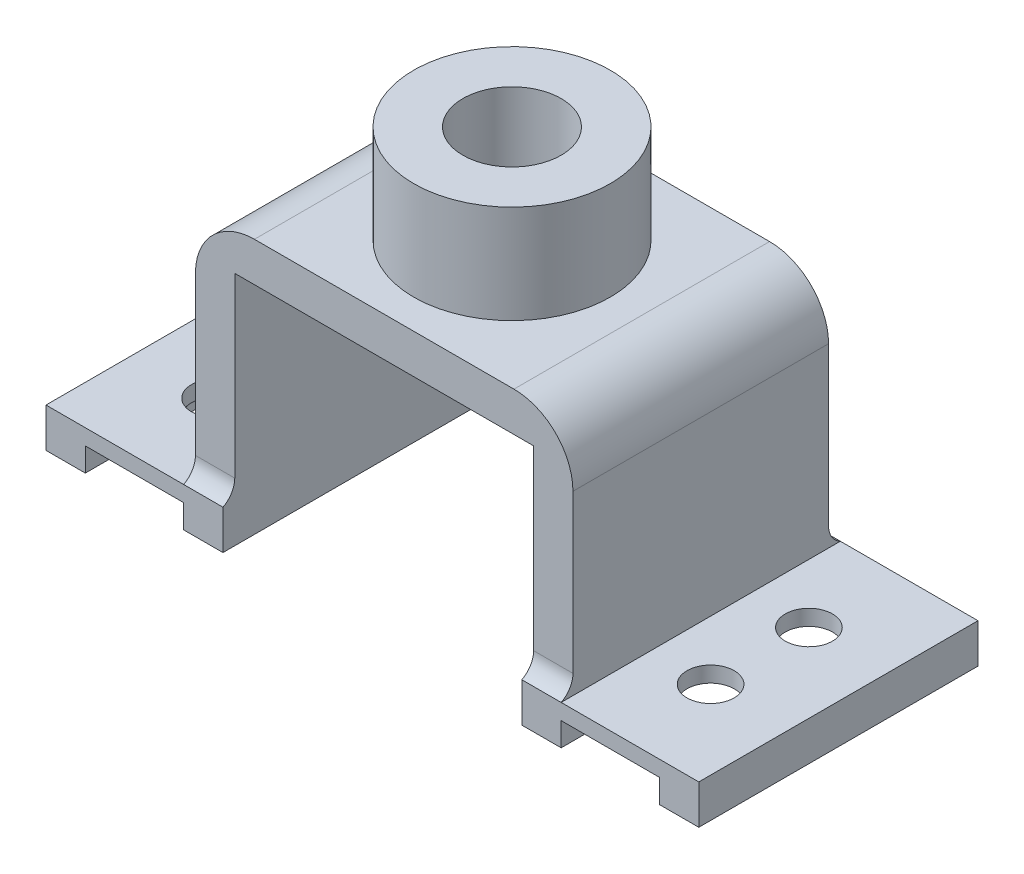
from build123d import *

# Parameters (mm, degrees)
SKETCH1_W           = 96
SKETCH1_H           = 70
BOSS_EXTRUDE1_DEPTH = 32.5
BOSS_EXTRUDE2_DEPTH = 35.5
SKETCH3_W           = 76
SKETCH3_H           = 60
CUT_EXTRUDE1_DEPTH  = 129.113231167
FILLET1_R           = 15
FILLET2_R           = 5.5
SKETCH4_R           = 25
SKETCH4_R_2         = 12.5
BOSS_EXTRUDE3_DEPTH = 25
HOLE1_D             = 12


with BuildPart() as part:
    # Sketch1 → Boss-Extrude1 (new, symmetric)
    with BuildSketch(Plane.XY):
        with Locations((0, 35)):
            Rectangle(SKETCH1_W, SKETCH1_H)
    extrude(amount=BOSS_EXTRUDE1_DEPTH, both=True)

    # Sketch2 → Boss-Extrude2 (add, symmetric)
    with BuildSketch(Plane.XY):
        Polygon((38, 0), (38, 10), (83, 10), (83, 0), (73, 0), (73, 6), (48, 6), (48, 0), align=None)
    boss_extrude2 = extrude(amount=BOSS_EXTRUDE2_DEPTH, both=True)

    # Mirror1: Boss-Extrude2 across plane
    add(boss_extrude2.mirror(Plane(origin=(0, 0, 0), x_dir=(0, 0, 1), z_dir=(1, 0, 0))))

    # Sketch3 → Cut-Extrude1 (cut, through all)
    with BuildSketch(Plane.XY.offset(32.5)):
        with Locations((0, 30)):
            Rectangle(SKETCH3_W, SKETCH3_H)
    extrude(amount=-CUT_EXTRUDE1_DEPTH, mode=Mode.SUBTRACT)

    # Fillet1
    fillet1_edges = [part.edges().sort_by_distance(p)[0] for p in [
        (-48, 70, 0),
        (48, 70, 0),
    ]]
    fillet(fillet1_edges, radius=FILLET1_R)

    # Fillet2
    # the kernel refuses this fillet: 5.5 mm, written as the material it adds along each edge
    with BuildSketch(Plane(origin=(-48, 10, -32.5), x_dir=(0, 1, 0), z_dir=(1, 0, 0)), Plane(origin=(48, 10, 32.5), x_dir=(0, 1, 0), z_dir=(-1, 0, 0))) as fillet2_piece_1:
        with BuildLine():
            CenterArc((4.898979486, -5.5), FILLET2_R, 90, 62.964308211)
            Line((0, -3), (-0.09797959, -2.95))
            ThreePointArc((-0.09797959, -2.95), (-0.11, -1.5), (-0.11, 0))
            Line((-0.11, 0), (0, 0.11))
            Line((0, 0.11), (4.898979486, 0.11))
            Line((4.898979486, 0.11), (4.898979486, 0))
        make_face()
    extrude(amount=10)
    with BuildSketch(Plane(origin=(48, 10, -32.5), x_dir=(0, 1, 0), z_dir=(-1, 0, 0)), Plane(origin=(-48, 10, 32.5), x_dir=(0, 1, 0), z_dir=(1, 0, 0))) as fillet2_piece_2:
        with BuildLine():
            CenterArc((4.898979486, 5.5), FILLET2_R, 207.035691789, 62.964308211)
            Line((0, 3), (-0.09797959, 2.95))
            ThreePointArc((-0.09797959, 2.95), (-0.11, 1.5), (-0.11, 0))
            Line((-0.11, 0), (0, -0.11))
            Line((0, -0.11), (4.898979486, -0.11))
            Line((4.898979486, -0.11), (4.898979486, 0))
        make_face()
    extrude(amount=10)

    # Sketch4 → Boss-Extrude3 (add)
    with BuildSketch(Plane(origin=(0, 70, 0), x_dir=(1, 0, 0), z_dir=(0, 1, 0))):
        with Locations(Location((0, 0, 0), (0, 0, 270))):
            Circle(SKETCH4_R)
        with Locations(Location((0, 0, 0), (0, 0, 270))):
            Circle(SKETCH4_R_2, mode=Mode.SUBTRACT)
    extrude(amount=BOSS_EXTRUDE3_DEPTH)

    # Hole1 (through all)
    with Locations(Plane(origin=(0, 10, 0), x_dir=(1, 0, 0), z_dir=(0, 1, 0))):
        with Locations((63, 12.5), (63, -12.5)):
            hole1 = Hole(HOLE1_D / 2)

    # Mirror2: Hole1 across plane
    add(hole1.mirror(Plane(origin=(0, 0, 0), x_dir=(0, 0, 1), z_dir=(1, 0, 0))), mode=Mode.SUBTRACT)


solid = part.part
